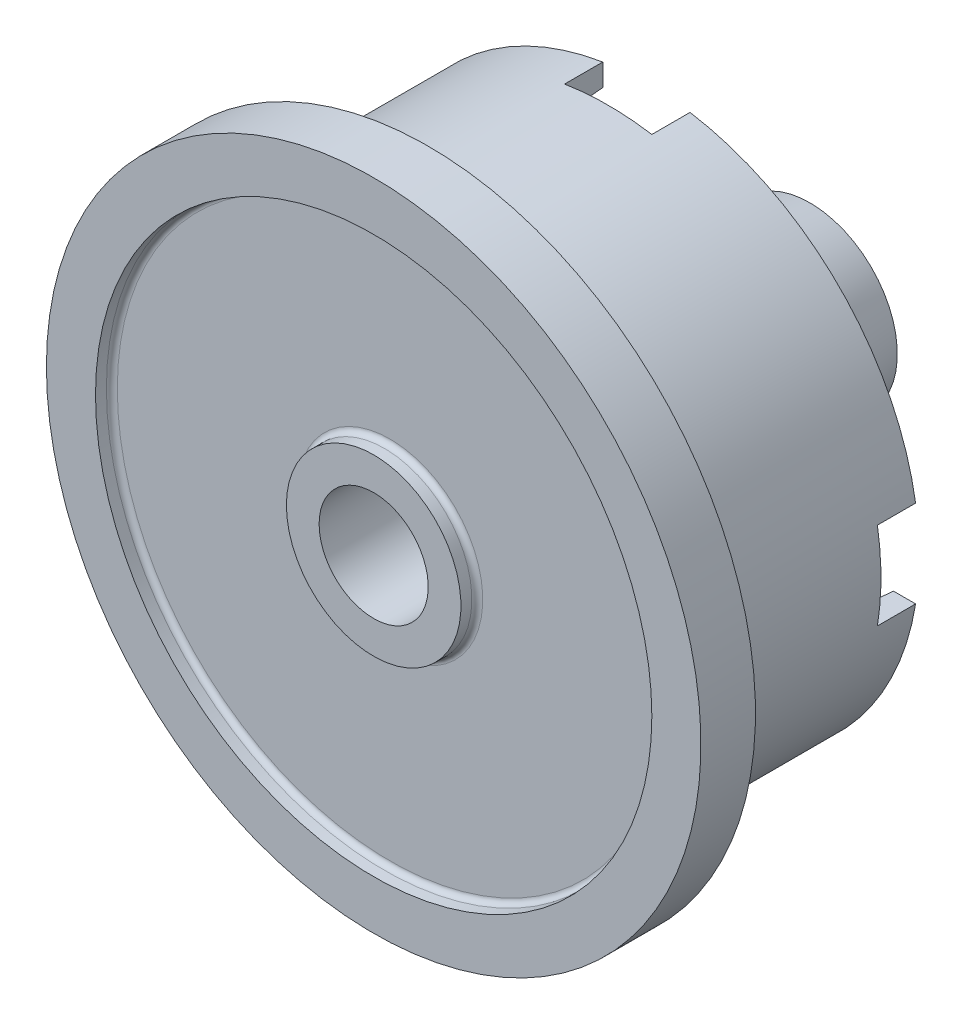
from build123d import *

# Parameters (mm, degrees)
CUT_EXTRUDE2_DEPTH = 7
CIRPATTERN1_COUNT  = 4


with BuildPart() as part:
    # Sketch2 → Revolve1 (revolve)
    with BuildSketch(Plane(origin=(0, 0, 0), x_dir=(1, 0, 0), z_dir=(0, 1, 0))):
        with BuildLine():
            Line((-50, -80), (-50, -70))
            Line((-50, -70), (-40, -70))
            Line((-40, -70), (-40, -30))
            Line((-40, -30), (-36, -30))
            Line((-36, -30), (-32, -70))
            Line((-32, -70), (-16, -70))
            Line((-16, -70), (-6, 0))
            Line((-6, 0), (0, 0))
            Line((0, 0), (0, -20))
            Line((0, -20), (-2, -20))
            Line((-2, -20), (-2, -60))
            Line((-2, -60), (0, -60))
            Line((0, -60), (0, -80))
            Line((0, -80), (-6, -80))
            Line((-6, -80), (-6, -78))
            ThreePointArc((-6, -78), (-6.292893219, -77.292893219), (-7, -77))
            Line((-7, -77), (-40, -77))
            ThreePointArc((-40, -77), (-40.707106781, -77.292893219), (-41, -78))
            Line((-41, -78), (-41, -80))
            Line((-41, -80), (-50, -80))
        make_face()
    revolve(axis=Axis((10, 0, 0), (0, 0, 1)))

    # Sketch3 → Cut-Extrude2 (cut)
    with BuildSketch(Plane(origin=(0, 0, 30), x_dir=(-1, 0, 0), z_dir=(0, 0, -1))):
        with BuildLine():
            ThreePointArc((39.355850717, -8), (40, 0), (39.355850717, 8))
            Line((39.355850717, 8), (31.231056256, 8))
            ThreePointArc((31.231056256, 8), (32, 0), (31.231056256, -8))
            Line((31.231056256, -8), (39.355850717, -8))
        make_face()
    cut_extrude2 = extrude(amount=-CUT_EXTRUDE2_DEPTH, mode=Mode.SUBTRACT)

    # CirPattern1: Cut-Extrude2 ×4 about axis
    cirpattern1_axis = Axis((10, 0, 30), (0, 0, -1))
    for i in range(1, CIRPATTERN1_COUNT):
        add(cut_extrude2.rotate(cirpattern1_axis, i * 360 / CIRPATTERN1_COUNT), mode=Mode.SUBTRACT)


solid = part.part
